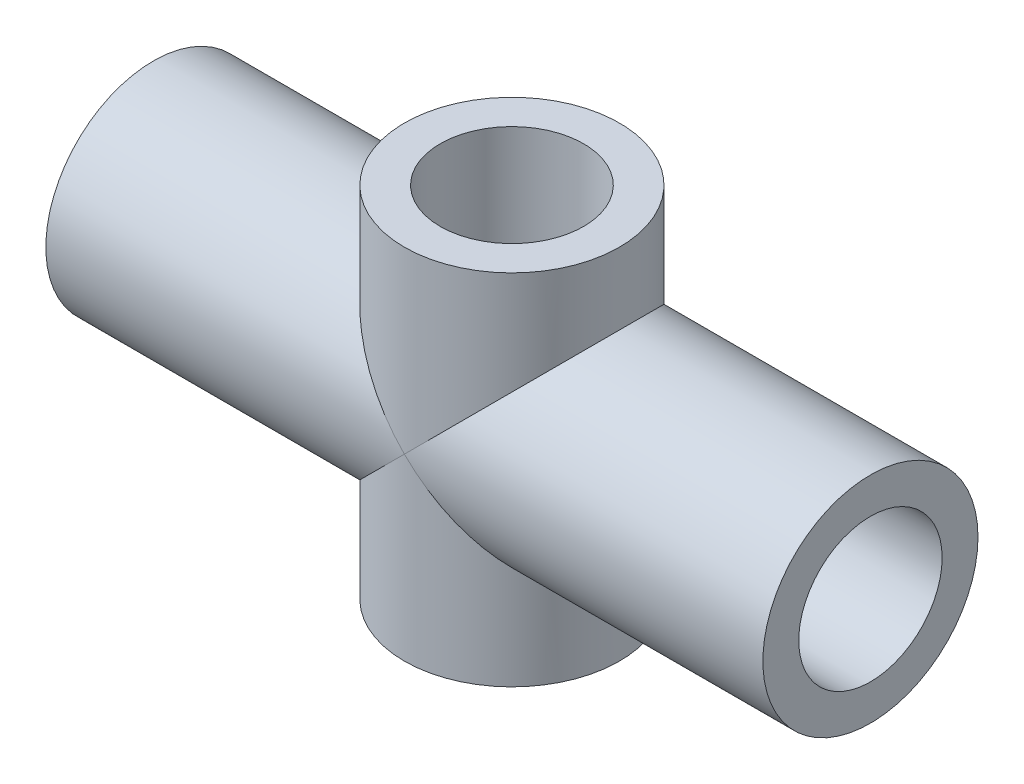
from build123d import *

# Parameters (mm, degrees)
BOSS_EXTRUDE1_DEPTH      = 5
BOSS_EXTRUDE1_DEPTH_BACK = 5
SKETCH1_R                = 3
BOSS_EXTRUDE3_DEPTH      = 10
BOSS_EXTRUDE3_DEPTH_BACK = 10
SKETCH2_R                = 3
SHELL2_START             = -5
SHELL2_OUTLINE_R         = 2
SHELL2_DEPTH             = 10
SHELL2_START_2           = -10
SHELL2_2_OUTLINE_R       = 2
SHELL2_2_DEPTH           = 20


with BuildPart() as part:
    # Sketch1 → Boss-Extrude1 (new, two sides: drawn at the far end of the back side and taken through both)
    with BuildSketch(Plane(origin=(0, 0, 0), x_dir=(1, 0, 0), z_dir=(0, 1, 0)).offset(-BOSS_EXTRUDE1_DEPTH_BACK)):
        with Locations(Location((0, 0, 0), (0, 0, 270))):
            Circle(SKETCH1_R)
    extrude(amount=BOSS_EXTRUDE1_DEPTH + BOSS_EXTRUDE1_DEPTH_BACK)

    # Sketch2 → Boss-Extrude3 (add, two sides: drawn at the far end of the back side and taken through both)
    with BuildSketch(Plane(origin=(0, 0, 0), x_dir=(0, 0, -1), z_dir=(1, 0, 0)).offset(-BOSS_EXTRUDE3_DEPTH_BACK)):
        Circle(SKETCH2_R)
    extrude(amount=BOSS_EXTRUDE3_DEPTH + BOSS_EXTRUDE3_DEPTH_BACK)

    # Shell2: read off the stored shape, not the designer's step
    # Shell2 outline → Shell2 (cut)
    with BuildSketch(Plane(origin=(0, 0, 0), x_dir=(1, 0, 0), z_dir=(0, 1, 0)).offset(SHELL2_START)):
        Circle(SHELL2_OUTLINE_R)
    extrude(amount=SHELL2_DEPTH, mode=Mode.SUBTRACT)

    # Shell2 2 outline → Shell2 2 (cut)
    with BuildSketch(Plane.YZ.offset(SHELL2_START_2)):
        Circle(SHELL2_2_OUTLINE_R)
    extrude(amount=SHELL2_2_DEPTH, mode=Mode.SUBTRACT)


solid = part.part
